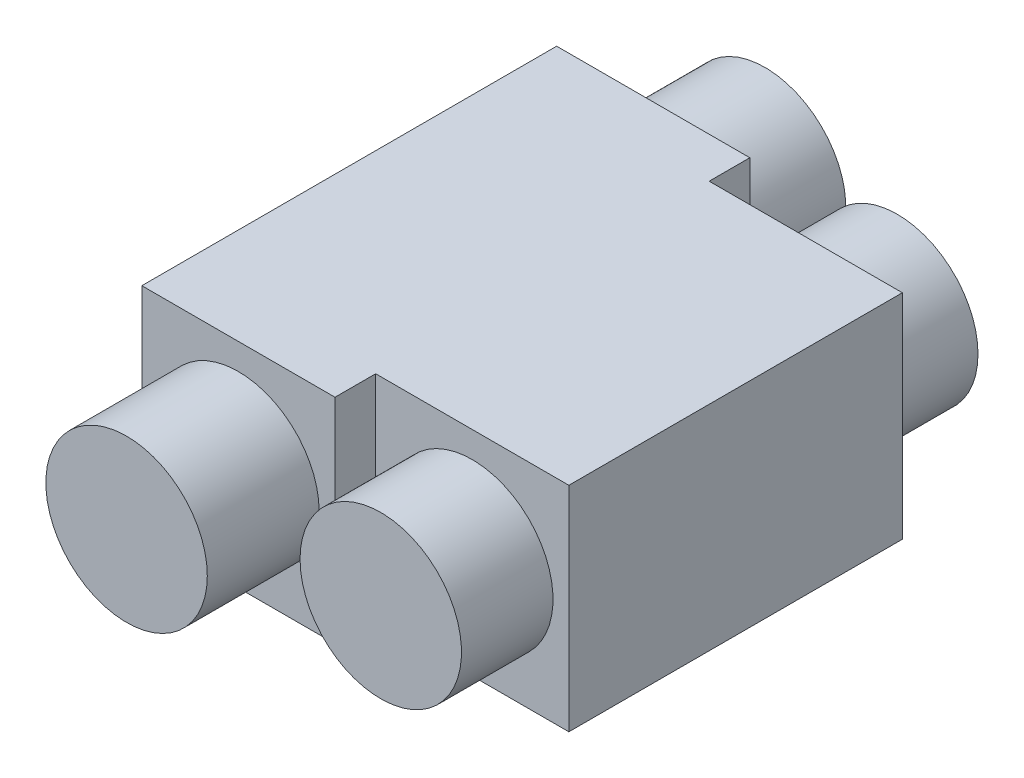
from build123d import *

# Parameters (mm, degrees)
SKETCH_1_W      = 190
SKETCH_1_H      = 164
EXTRUDE_2_DEPTH = 105
SKETCH_1_5_W    = 95
SKETCH_1_5_H    = 204
EXTRUDE_3_DEPTH = 105
SKETCH_2_R      = 39.7
EXTRUDE_4_DEPTH = 55
SKETCH_3_R      = 39.7
EXTRUDE_5_DEPTH = 45
EXTRUDE_START   = 55
SKETCH_4_R      = 39.7
EXTRUDE_6_DEPTH = 55
EXTRUDE_START_2 = 45
SKETCH_5_R      = 39.7
EXTRUDE_7_DEPTH = 45


with BuildPart() as part:
    # 草图1 → 凸台-拉伸2 (new body)
    with BuildSketch(Plane(origin=(0, 0, 0), x_dir=(1, 0, 0), z_dir=(0, 1, 0))):
        Rectangle(SKETCH_1_W, SKETCH_1_H)
    extrude(amount=EXTRUDE_2_DEPTH)

    # 草图1<5> → 凸台-拉伸3 (add)
    with BuildSketch(Plane(origin=(0, 0, 0), x_dir=(1, 0, 0), z_dir=(0, 1, 0))):
        with Locations((-47.5, 0)):
            Rectangle(SKETCH_1_5_W, SKETCH_1_5_H)
    extrude(amount=EXTRUDE_3_DEPTH)

    # 草图2 → 凸台-拉伸4 (add)
    with BuildSketch(Plane.XY.offset(102)):
        with Locations((-47.5, 52.5)):
            Circle(SKETCH_2_R)
    extrude(amount=EXTRUDE_4_DEPTH)

    # 草图3 → 凸台-拉伸5 (add)
    with BuildSketch(Plane.XY.offset(82)):
        with Locations((47.5, 52.5)):
            Circle(SKETCH_3_R)
    extrude(amount=EXTRUDE_5_DEPTH)

    # 草图4 → 凸台-拉伸6 (add)
    with BuildSketch(Plane(origin=(0, 0, -102), x_dir=(-1, 0, 0), z_dir=(0, 0, -1)).offset(EXTRUDE_START)):
        with Locations((47.5, 52.5)):
            Circle(SKETCH_4_R)
    extrude(amount=-EXTRUDE_6_DEPTH)

    # 草图5 → 凸台-拉伸7 (add)
    with BuildSketch(Plane(origin=(0, 0, -82), x_dir=(-1, 0, 0), z_dir=(0, 0, -1)).offset(EXTRUDE_START_2)):
        with Locations((-47.5, 52.5)):
            Circle(SKETCH_5_R)
    extrude(amount=-EXTRUDE_7_DEPTH)


solid = part.part
